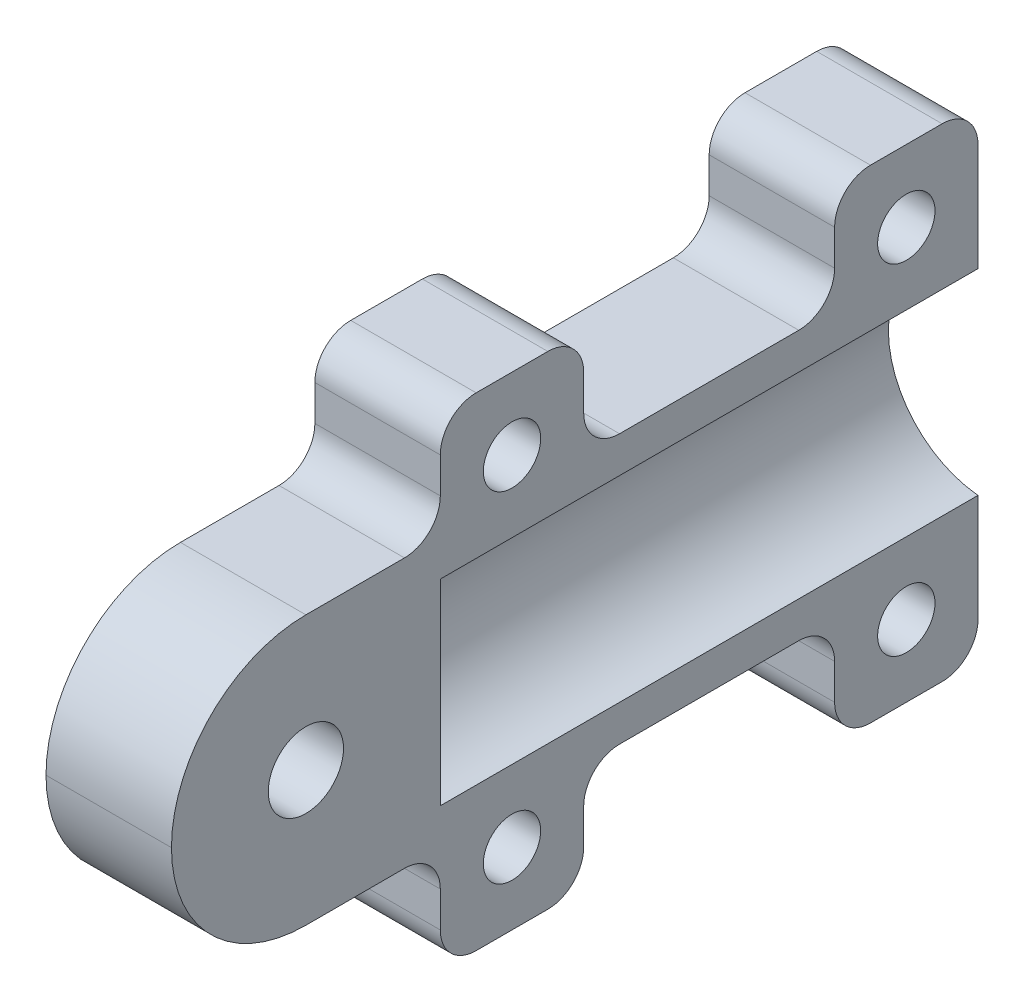
from build123d import *

# Parameters (mm, degrees)
SKETCH_1_W          = 15
SKETCH_1_H          = 15
SKETCH_1_R          = 5.5
EXTRUDE_1_DEPTH     = 45
SKETCH_5_W          = 15
SKETCH_5_H          = 15
EXTRUDE_3_DEPTH     = 15
FILLET_2_R          = 7.5
SKETCH_6_R          = 2.1
CUT_EXTRUDE_1_DEPTH = 49.023431781
CUT_EXTRUDE_2_DEPTH = 8
SKETCH_9_W          = 8
SKETCH_9_H          = 8
SKETCH_9_R          = 1.6
EXTRUDE_4_DEPTH     = 7
FILLET_3_R          = 2
SKETCH_11_R         = 3.2
CUT_EXTRUDE_3_DEPTH = 3.75


with BuildPart() as part:
    # ｽｹｯﾁ1 → ﾎﾞｽ - 押し出し1 (new body)
    with BuildSketch(Plane.XY):
        Rectangle(SKETCH_1_W, SKETCH_1_H)
        with Locations(Location((0, 0, 0), (0, 0, 180))):
            Circle(SKETCH_1_R, mode=Mode.SUBTRACT)
    extrude(amount=EXTRUDE_1_DEPTH)

    # ｽｹｯﾁ5 → ﾎﾞｽ - 押し出し3 (add)
    with BuildSketch(Plane.XY.offset(45)):
        Rectangle(SKETCH_5_W, SKETCH_5_H)
    extrude(amount=-EXTRUDE_3_DEPTH)

    # ﾌｨﾚｯﾄ2
    fillet_2_edges = [part.edges().sort_by_distance(p)[0] for p in [
        (0, -7.5, 45),
        (0, 7.5, 45),
    ]]
    fillet(fillet_2_edges, radius=FILLET_2_R - 0.0001)  # a hair under: the kernel refuses the full size

    # ｽｹｯﾁ6 → ｶｯﾄ - 押し出し1 (cut, through all)
    with BuildSketch(Plane(origin=(7.5, 0, 0), x_dir=(0, 0, -1), z_dir=(1, 0, 0))):
        with Locations((-37.5, 0)):
            Circle(SKETCH_6_R)
    extrude(amount=-CUT_EXTRUDE_1_DEPTH, mode=Mode.SUBTRACT)

    # ｽｹｯﾁ7 → ｶｯﾄ - 押し出し2 (cut)
    with BuildSketch(Plane(origin=(7.5, 0, 0), x_dir=(0, 0, -1), z_dir=(1, 0, 0))):
        with BuildLine():
            Line((-37.5, -9.5), (2, -9.5))
            Line((2, -9.5), (2, 9.5))
            Line((2, 9.5), (-37.5, 9.5))
            ThreePointArc((-37.5, 9.5), (-44.217514421, 6.717514421), (-47, 0))
            ThreePointArc((-47, 0), (-44.217514421, -6.717514421), (-37.5, -9.5))
        make_face()
    extrude(amount=-CUT_EXTRUDE_2_DEPTH, mode=Mode.SUBTRACT)

    # ｽｹｯﾁ9 → ﾎﾞｽ - 押し出し4 (add)
    # profile 1 of 4: a face of its own
    with BuildSketch(Plane(origin=(-0.5, 0, 0), x_dir=(0, 0, -1), z_dir=(1, 0, 0))):
        with Locations((-4, -9.477225575)):
            Rectangle(SKETCH_9_W, SKETCH_9_H)
        with Locations((-4, -9.477225575)):
            Circle(SKETCH_9_R, mode=Mode.SUBTRACT)
    # profile 2 of 4: a face of its own
    with BuildSketch(Plane(origin=(-0.5, 0, 0), x_dir=(0, 0, -1), z_dir=(1, 0, 0))):
        with Locations((-26, 9.477225575)):
            Rectangle(SKETCH_9_W, SKETCH_9_H)
        with Locations((-26, 9.477225575)):
            Circle(SKETCH_9_R, mode=Mode.SUBTRACT)
    # profile 3 of 4: a face of its own
    with BuildSketch(Plane(origin=(-0.5, 0, 0), x_dir=(0, 0, -1), z_dir=(1, 0, 0))):
        with Locations((-4, 9.477225575)):
            Rectangle(SKETCH_9_W, SKETCH_9_H)
        with Locations((-4, 9.477225575)):
            Circle(SKETCH_9_R, mode=Mode.SUBTRACT)
    # profile 4 of 4: a face of its own
    with BuildSketch(Plane(origin=(-0.5, 0, 0), x_dir=(0, 0, -1), z_dir=(1, 0, 0))):
        with Locations((-26, -9.477225575)):
            Rectangle(SKETCH_9_W, SKETCH_9_H)
        with Locations((-26, -9.477225575)):
            Circle(SKETCH_9_R, mode=Mode.SUBTRACT)
    extrude(amount=-EXTRUDE_4_DEPTH)

    # ﾌｨﾚｯﾄ3
    fillet_3_edges = [part.edges().sort_by_distance(p)[0] for p in [
        (-4, 13.477225575, 22),
        (-4, 7.5, 30),
        (-4, 13.477225575, 30),
        (-4, 7.5, 22),
        (-4, 13.477225575, 0),
        (-4, 7.5, 8),
        (-4, 13.477225575, 8),
        (-4, -13.477225575, 30),
        (-4, -7.5, 22),
        (-4, -13.477225575, 22),
        (-4, -7.5, 30),
        (-4, -13.477225575, 8),
        (-4, -13.477225575, 0),
        (-4, -7.5, 8),
    ]]
    fillet(fillet_3_edges, radius=FILLET_3_R)

    # ｽｹｯﾁ11 → ｶｯﾄ - 押し出し3 (cut)
    with BuildSketch(Plane.ZY.offset(7.5)):
        with Locations((4, 9.477225575)):
            Circle(SKETCH_11_R)
        with Locations((26, 9.477225575)):
            Circle(SKETCH_11_R)
        with Locations((26, -9.477225575)):
            Circle(SKETCH_11_R)
        with Locations((4, -9.477225575)):
            Circle(SKETCH_11_R)
    extrude(amount=-CUT_EXTRUDE_3_DEPTH, mode=Mode.SUBTRACT)


solid = part.part
